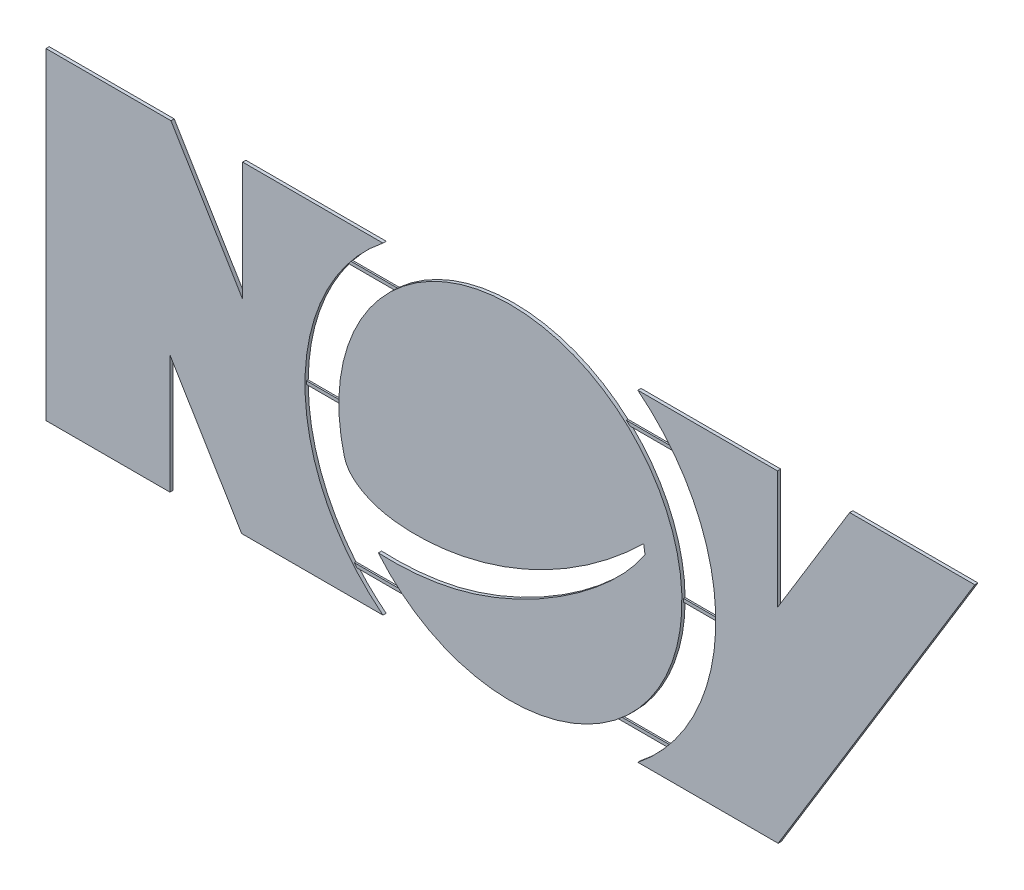
from build123d import *

# Parameters (mm, degrees)
BOSS_EXTRUDE1_DEPTH   = 0.6
BOSS_EXTRUDE1_2_DEPTH = 0.6
BOSS_EXTRUDE1_3_DEPTH = 0.6
BOSS_EXTRUDE2_DEPTH   = 0.3


with BuildPart() as part:
    # Sketch1 → Boss-Extrude1 (new body)
    with BuildSketch(Plane.XY):
        with BuildLine():
            Line((23.3158368, 62.061281034), (0, 62.061281034))
            Line((0, 62.061281034), (0, 1.950002877))
            Line((0, 1.950002877), (23.111234398, 1.950002877))
            Line((23.111234398, 1.950002877), (23.111234398, 24.145438461))
            Line((23.111234398, 24.145438461), (36.497449361, 1.950002877))
            Line((36.497449361, 1.950002877), (62.856663932, 1.950002877))
            ThreePointArc((62.856663932, 1.950002877), (48.313215527, 32.007787602), (62.865529661, 62.061281034))
            Line((62.865529661, 62.061281034), (36.689087616, 62.061281034))
            Line((36.689087616, 62.061281034), (36.689087616, 39.887341061))
            Line((36.689087616, 39.887341061), (23.3158368, 62.061281034))
        make_face()
    extrude(amount=BOSS_EXTRUDE1_DEPTH)



with BuildPart() as body_2:
    # Sketch1 → Boss-Extrude1 2 (new body)
    with BuildSketch(Plane.XY):
        with BuildLine():
            ThreePointArc((110.403147038, 62.061281034), (124.955461171, 32.007787602), (110.412012767, 1.950002877))
            Line((110.412012767, 1.950002877), (136.586879163, 1.950002877))
            Line((136.586879163, 1.950002877), (173.268679959, 62.061281034))
            Line((173.268679959, 62.061281034), (149.928389856, 62.061281034))
            Line((149.928389856, 62.061281034), (136.46819788, 40.00376678))
            Line((136.46819788, 40.00376678), (136.46819788, 62.061281034))
            Line((136.46819788, 62.061281034), (110.403147038, 62.061281034))
        make_face()
    extrude(amount=BOSS_EXTRUDE1_2_DEPTH)


with BuildPart() as body_3:
    # Sketch1 → Boss-Extrude1 3 (new body)
    with BuildSketch(Plane.XY):
        with BuildLine():
            add(Edge.make_bspline(
                [(55.665817619, 23.934470135), (56.300995164, 21.632545966), (60.312610701, 18.883485306), (68.000137108, 17.687938813), (77.626036713, 18.475223123), (88.050691987, 21.709552098), (99.970855751, 27.901244554), (107.303663525, 33.692026699), (111.490621497, 37.816257369)],
                knots=[0.00273107, 0.00273107, 0.00273107, 0.00273107, 0.111443696, 0.211566761, 0.368518187, 0.562067367, 0.722926062, 1, 1, 1, 1], degree=3))
            Line((111.490621497, 37.816257369), (111.75160581, 36.138246697))
            add(Edge.make_bspline(
                [(61.999805678, 11.574793615), (65.651806063, 11.384741592), (84.022958412, 12.171806498), (105.244079008, 26.24652902), (111.75160581, 36.138246697)],
                knots=[0, 0, 0, 0, 0.285157646, 1, 1, 1, 1], degree=3))
            ThreePointArc((61.999805678, 11.574793615), (115.114424161, 46.59738201), (55.665817619, 23.934470135))
        make_face()
    extrude(amount=BOSS_EXTRUDE1_3_DEPTH)


with BuildPart() as part_1:
    add(part.part)

    add(body_2.part)  # Boss-Extrude2 merges body 2

    add(body_3.part)  # Boss-Extrude2 merges body 3
    # Sketch2 → Boss-Extrude2 (add)
    with BuildSketch(Plane.XY):
        with BuildLine():
            Line((65.288187558, 55.844919694), (56.63383608, 55.844919694))
            ThreePointArc((56.63383608, 55.844919694), (56.398742844, 55.546078646), (56.166626305, 55.244919694))
            Line((56.166626305, 55.244919694), (64.63639539, 55.244919694))
            ThreePointArc((64.63639539, 55.244919694), (64.960215166, 55.547175229), (65.288187558, 55.844919694))
        make_face()
        with BuildLine():
            Line((116.634840619, 55.844919694), (107.980489141, 55.844919694))
            ThreePointArc((107.980489141, 55.844919694), (108.308461533, 55.547175229), (108.632281309, 55.244919694))
            Line((108.632281309, 55.244919694), (117.102050394, 55.244919694))
            ThreePointArc((117.102050394, 55.244919694), (116.869933855, 55.546078646), (116.634840619, 55.844919694))
        make_face()
        with BuildLine():
            Line((54.634511424, 32.386297359), (48.315140731, 32.386297359))
            ThreePointArc((48.315140731, 32.386297359), (48.313307535, 32.086299938), (48.313822955, 31.786297359))
            Line((48.313822955, 31.786297359), (54.632933422, 31.786297359))
            ThreePointArc((54.632933422, 31.786297359), (54.632316231, 32.086301058), (54.634511424, 32.386297359))
        make_face()
        with BuildLine():
            Line((124.953535967, 32.386297359), (118.634165275, 32.386297359))
            ThreePointArc((118.634165275, 32.386297359), (118.636360468, 32.086301058), (118.635743276, 31.786297359))
            Line((118.635743276, 31.786297359), (124.954853744, 31.786297359))
            ThreePointArc((124.954853744, 31.786297359), (124.955369164, 32.086299938), (124.953535967, 32.386297359))
        make_face()
        with BuildLine():
            Line((66.093618581, 7.462059575), (57.201479987, 7.462059575))
            ThreePointArc((57.201479987, 7.462059575), (57.455341197, 7.160746592), (57.7122869, 6.862059575))
            Line((57.7122869, 6.862059575), (66.83249305, 6.862059575))
            ThreePointArc((66.83249305, 6.862059575), (66.460825045, 7.159312475), (66.093618581, 7.462059575))
        make_face()
        with BuildLine():
            Line((116.067196712, 7.462059575), (107.175058117, 7.462059575))
            ThreePointArc((107.175058117, 7.462059575), (106.807851654, 7.159312475), (106.436183649, 6.862059575))
            Line((106.436183649, 6.862059575), (115.556389799, 6.862059575))
            ThreePointArc((115.556389799, 6.862059575), (115.813335501, 7.160746592), (116.067196712, 7.462059575))
        make_face()
    extrude(amount=BOSS_EXTRUDE2_DEPTH)


solid = part_1.part
